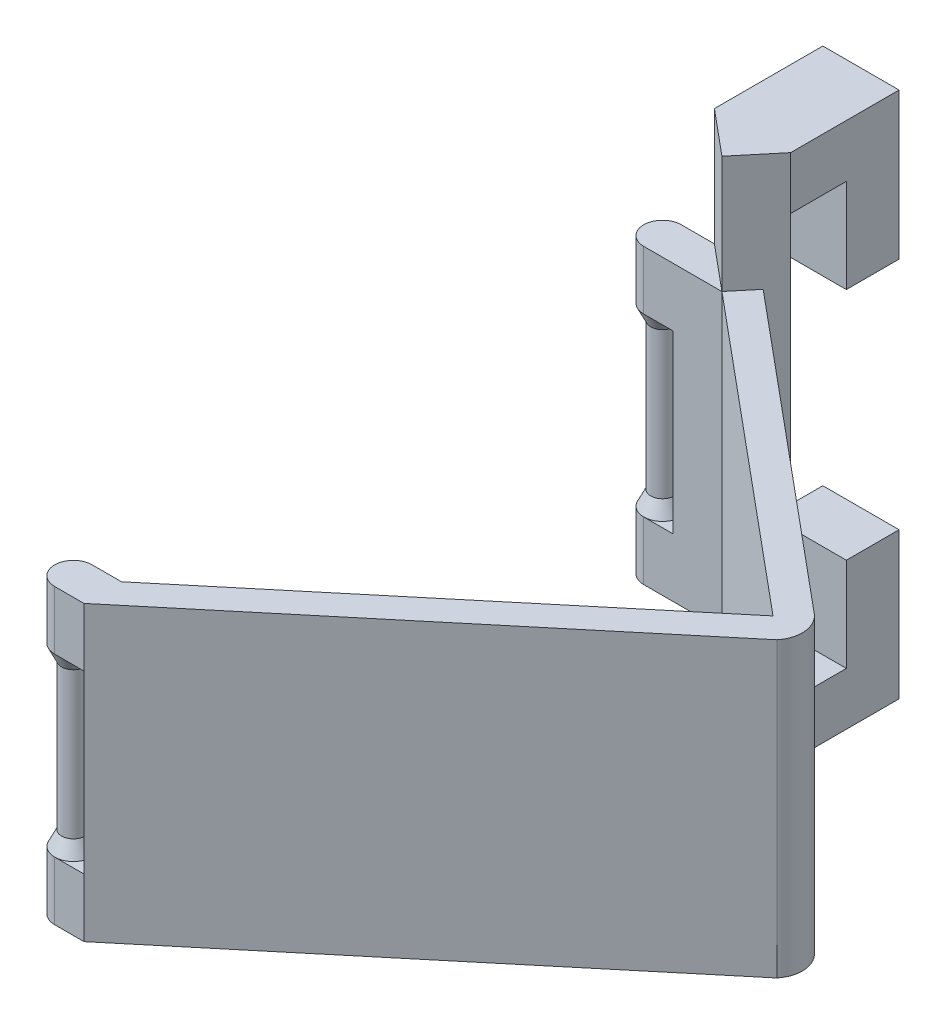
from build123d import *

# Parameters (mm, degrees)
EXTRUDE_1_DEPTH  = 50
EXTRUDE_START    = -50
EXTRUDE_3_DEPTH  = 70
SKETCH_5_W       = 13.017082793
SKETCH_5_H       = 9
EXTRUDE_4_DEPTH  = 18.5
SKETCH_6_W       = 13.017082793
SKETCH_6_H       = 9
EXTRUDE_5_DEPTH  = 16
EXTRUDE_6_DEPTH  = 50
EXTRUDE_7_DEPTH  = 10
EXTRUDE_8_DEPTH  = 10
SKETCH_11_R      = 2
EXTRUDE_9_DEPTH  = 30
SKETCH_15_R      = 2
EXTRUDE_10_DEPTH = 30


with BuildPart() as part:
    # 草图1 → 凸台-拉伸1 (new body)
    with BuildSketch(Plane(origin=(0, 0, 0), x_dir=(1, 0, 0), z_dir=(0, 1, 0))):
        with BuildLine():
            Line((7.810249676, 50), (0, 50))
            Line((0, 50), (60, 0))
            Line((60, 0), (-0.663965605, -50.553304671))
            Line((-0.663965605, -50.553304671), (-0.663965605, -56.955148667))
            Line((-0.663965605, -56.955148667), (63.841106398, -3.200921998))
            ThreePointArc((63.841106398, -3.200921998), (64.979466032, 0.45267873), (63.200921998, 3.841106398))
            Line((63.200921998, 3.841106398), (7.810249676, 50))
        make_face()
    extrude(amount=EXTRUDE_1_DEPTH)

    # 草图4 → 凸台-拉伸3 (add)
    with BuildSketch(Plane(origin=(0, 50, 0), x_dir=(1, 0, 0), z_dir=(0, 1, 0)).offset(EXTRUDE_START)):
        Polygon((0, 50), (7.682212796, 43.598156003), (13.017082793, 50), align=None)
    extrude_3 = extrude(amount=EXTRUDE_3_DEPTH)

    # 草图5 → 凸台-拉伸4 (add)
    with BuildSketch(Plane(origin=(0, 0, -50), x_dir=(-1, 0, 0), z_dir=(0, 0, -1))):
        with Locations((-6.508541397, 65.5)):
            Rectangle(SKETCH_5_W, SKETCH_5_H)
    extrude_4 = extrude(amount=EXTRUDE_4_DEPTH)

    # 草图6 → 凸台-拉伸5 (add)
    with BuildSketch(Plane.XZ.offset(-61)):
        with Locations((6.508541397, -64)):
            Rectangle(SKETCH_6_W, SKETCH_6_H)
    extrude_5 = extrude(amount=EXTRUDE_5_DEPTH)

    # 镜向4: 凸台-拉伸3, 凸台-拉伸4, 凸台-拉伸5 across plane
    add(extrude_3.mirror(Plane(origin=(0, 25, 0), x_dir=(0, 0, 1), z_dir=(0, -1, 0))))
    add(extrude_4.mirror(Plane(origin=(0, 25, 0), x_dir=(0, 0, 1), z_dir=(0, -1, 0))))
    add(extrude_5.mirror(Plane(origin=(0, 25, 0), x_dir=(0, 0, 1), z_dir=(0, -1, 0))))

    # 草图8 → 凸台-拉伸6 (add)
    with BuildSketch(Plane(origin=(0, 50, 0), x_dir=(1, 0, 0), z_dir=(0, 1, 0))):
        Polygon((7.682212796, 43.598156003), (-0.663965605, 43.598156003), (-0.663965605, 50), (0, 50), align=None)
    extrude(amount=-EXTRUDE_6_DEPTH)

    # 草图9 → 凸台-拉伸7 (add)
    with BuildSketch(Plane.XZ):
        with BuildLine():
            Line((-0.663965605, 50.553304671), (-0.663965605, 56.955148667))
            Line((-0.663965605, 56.955148667), (-5.663965605, 56.955148667))
            ThreePointArc((-5.663965605, 56.955148667), (-8.864887603, 53.754226669), (-5.663965605, 50.553304671))
            Line((-5.663965605, 50.553304671), (-0.663965605, 50.553304671))
        make_face()
    extrude_7 = extrude(amount=-EXTRUDE_7_DEPTH)

    # 草图10 → 凸台-拉伸8 (add)
    with BuildSketch(Plane.XZ):
        with BuildLine():
            Line((-0.663965605, -50), (-0.663965605, -43.598156003))
            Line((-0.663965605, -43.598156003), (-5.663965605, -43.598156003))
            ThreePointArc((-5.663965605, -43.598156003), (-8.864887603, -46.799078002), (-5.663965605, -50))
            Line((-5.663965605, -50), (-0.663965605, -50))
        make_face()
    extrude_8 = extrude(amount=-EXTRUDE_8_DEPTH)

    # 镜向5: 凸台-拉伸7, 凸台-拉伸8 across plane
    add(extrude_7.mirror(Plane(origin=(0, 25, 0), x_dir=(0, 0, 1), z_dir=(0, -1, 0))))
    add(extrude_8.mirror(Plane(origin=(0, 25, 0), x_dir=(0, 0, 1), z_dir=(0, -1, 0))))

    # 草图11 → 凸台-拉伸9 (add)
    with BuildSketch(Plane.XZ.offset(-40)):
        with Locations((-5.663965605, 53.754226669)):
            Circle(SKETCH_11_R)
    extrude(amount=EXTRUDE_9_DEPTH)

    # 草图14 → 旋转1 (revolve)
    with BuildSketch(Plane(origin=(0, 0, 53.754226669), x_dir=(-1, 0, 0), z_dir=(0, 0, -1))):
        Polygon((7.663965605, 12.5), (7.663965605, 10), (8.864887603, 10), align=None)
    revolve_1 = revolve(axis=Axis((-5.663965605, 10, 53.754226669), (0, 1, 0)))

    # 镜向6: 旋转1 across plane
    add(revolve_1.mirror(Plane(origin=(0, 25, 0), x_dir=(0, 0, 1), z_dir=(0, -1, 0))))

    # 草图15 → 凸台-拉伸10 (add)
    with BuildSketch(Plane(origin=(0, 10, 0), x_dir=(1, 0, 0), z_dir=(0, 1, 0))):
        with Locations((-5.663965605, 46.799078002)):
            Circle(SKETCH_15_R)
    extrude(amount=EXTRUDE_10_DEPTH)

    # 草图17 → 旋转2 (revolve)
    with BuildSketch(Plane.XY.offset(-46.799078002)):
        Polygon((-7.663965605, 10), (-7.663965605, 12.5), (-8.864887603, 10), align=None)
    revolve_2 = revolve(axis=Axis((-5.663965605, 40, -46.799078002), (0, -1, 0)))

    # 镜向7: 旋转2 across plane
    add(revolve_2.mirror(Plane(origin=(0, 25, 0), x_dir=(0, 0, 1), z_dir=(0, -1, 0))))


solid = part.part
